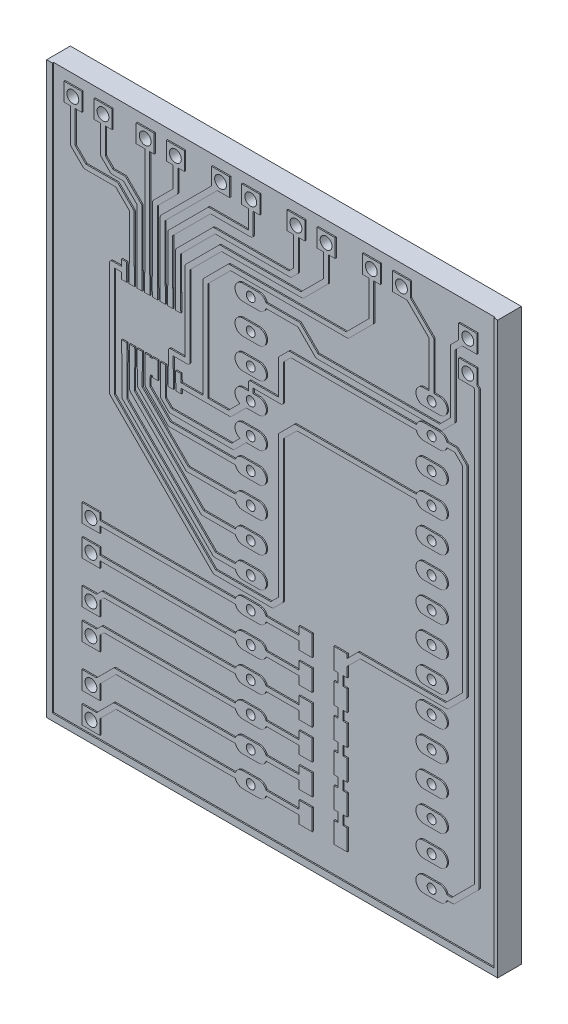
from build123d import *

# Parameters (mm, degrees)
SKETCH2_W           = 38
SKETCH2_H           = 48
BOSS_EXTRUDE1_DEPTH = 2
MODEL_W             = 37.1856
MODEL_H             = 47.8536
CUT_EXTRUDE1_DEPTH  = 0.1
MODEL_5_R           = 0.3750056
MODEL_5_R_2         = 0.499999
CUT_EXTRUDE2_DEPTH  = 62.253571324


with BuildPart() as part:
    # Sketch2 → Boss-Extrude1 (new body)
    with BuildSketch(Plane.XY):
        with Locations((19, 24)):
            Rectangle(SKETCH2_W, SKETCH2_H)
    extrude(amount=-BOSS_EXTRUDE1_DEPTH)

    # Model → Cut-Extrude1 (cut)
    with BuildSketch(Plane.XY):
        with Locations((19.090426819, 24.502154165)):
            Rectangle(MODEL_W, MODEL_H)
        with BuildLine():
            Line((2.9718, 0.9398), (2.9718, 2.4638))
            Line((2.9718, 2.4638), (4.20841808, 2.4638))
            Line((4.20841808, 2.4638), (5.622110349, 3.877492269))
            ThreePointArc((5.622110349, 3.877492269), (5.688034023, 3.921541059), (5.765796298, 3.937008938))
            Line((5.765796298, 3.937008938), (15.903743147, 3.937008938))
            ThreePointArc((15.903743147, 3.937008938), (16.144601357, 4.270046839), (16.5354, 4.397339187))
            Line((16.5354, 4.397339187), (17.8562, 4.397339187))
            ThreePointArc((17.8562, 4.397339187), (18.246998643, 4.270046839), (18.487856853, 3.937008938))
            Line((18.487856853, 3.937008938), (21.2598, 3.937008938))
            Line((21.2598, 3.937008938), (21.2598, 4.6101))
            Line((21.2598, 4.6101), (22.3774, 4.6101))
            Line((22.3774, 4.6101), (22.3774, 2.8575))
            Line((22.3774, 2.8575), (21.2598, 2.8575))
            Line((21.2598, 2.8575), (21.2598, 3.5306))
            Line((21.2598, 3.5306), (18.487859728, 3.5306))
            ThreePointArc((18.487859728, 3.5306), (18.247002437, 3.197555925), (17.8562, 3.070260813))
            Line((17.8562, 3.070260813), (16.5354, 3.070260813))
            ThreePointArc((16.5354, 3.070260813), (16.144597563, 3.197555925), (15.903740272, 3.5306))
            Line((15.903740272, 3.5306), (5.84996928, 3.5306))
            Line((5.84996928, 3.5306), (4.4958, 2.17643072))
            Line((4.4958, 2.17643072), (4.4958, 0.9398))
            Line((4.4958, 0.9398), (2.9718, 0.9398))
        make_face(mode=Mode.SUBTRACT)
        with BuildLine():
            Line((2.9718, 3.4798), (2.9718, 5.0038))
            Line((2.9718, 5.0038), (4.20841808, 5.0038))
            Line((4.20841808, 5.0038), (5.622110349, 6.417492269))
            ThreePointArc((5.622110349, 6.417492269), (5.688034023, 6.461541059), (5.765796298, 6.477008938))
            Line((5.765796298, 6.477008938), (15.903743147, 6.477008938))
            ThreePointArc((15.903743147, 6.477008938), (16.144601357, 6.810046839), (16.5354, 6.937339187))
            Line((16.5354, 6.937339187), (17.8562, 6.937339187))
            ThreePointArc((17.8562, 6.937339187), (18.246998643, 6.810046839), (18.487856853, 6.477008938))
            Line((18.487856853, 6.477008938), (21.2598, 6.477008938))
            Line((21.2598, 6.477008938), (21.2598, 7.1501))
            Line((21.2598, 7.1501), (22.3774, 7.1501))
            Line((22.3774, 7.1501), (22.3774, 5.3975))
            Line((22.3774, 5.3975), (21.2598, 5.3975))
            Line((21.2598, 5.3975), (21.2598, 6.0706))
            Line((21.2598, 6.0706), (18.487859728, 6.0706))
            ThreePointArc((18.487859728, 6.0706), (18.247002437, 5.737555925), (17.8562, 5.610260813))
            Line((17.8562, 5.610260813), (16.5354, 5.610260813))
            ThreePointArc((16.5354, 5.610260813), (16.144597563, 5.737555925), (15.903740272, 6.0706))
            Line((15.903740272, 6.0706), (5.84996928, 6.0706))
            Line((5.84996928, 6.0706), (4.4958, 4.71643072))
            Line((4.4958, 4.71643072), (4.4958, 3.4798))
            Line((4.4958, 3.4798), (2.9718, 3.4798))
        make_face(mode=Mode.SUBTRACT)
        with BuildLine():
            Line((2.9718, 7.0358), (2.9718, 8.5598))
            Line((2.9718, 8.5598), (4.20841808, 8.5598))
            Line((4.20841808, 8.5598), (4.606110349, 8.957492269))
            ThreePointArc((4.606110349, 8.957492269), (4.672034023, 9.001541059), (4.749796298, 9.017008938))
            Line((4.749796298, 9.017008938), (15.903743147, 9.017008938))
            ThreePointArc((15.903743147, 9.017008938), (16.144601357, 9.350046839), (16.5354, 9.477339187))
            Line((16.5354, 9.477339187), (17.8562, 9.477339187))
            ThreePointArc((17.8562, 9.477339187), (18.246998643, 9.350046839), (18.487856853, 9.017008938))
            Line((18.487856853, 9.017008938), (21.2598, 9.017008938))
            Line((21.2598, 9.017008938), (21.2598, 9.6901))
            Line((21.2598, 9.6901), (22.3774, 9.6901))
            Line((22.3774, 9.6901), (22.3774, 7.9375))
            Line((22.3774, 7.9375), (21.2598, 7.9375))
            Line((21.2598, 7.9375), (21.2598, 8.6106))
            Line((21.2598, 8.6106), (18.487859728, 8.6106))
            ThreePointArc((18.487859728, 8.6106), (18.247002437, 8.277555925), (17.8562, 8.150260813))
            Line((17.8562, 8.150260813), (16.5354, 8.150260813))
            ThreePointArc((16.5354, 8.150260813), (16.144597563, 8.277555925), (15.903740272, 8.6106))
            Line((15.903740272, 8.6106), (4.83396928, 8.6106))
            Line((4.83396928, 8.6106), (4.4958, 8.27243072))
            Line((4.4958, 8.27243072), (4.4958, 7.0358))
            Line((4.4958, 7.0358), (2.9718, 7.0358))
        make_face(mode=Mode.SUBTRACT)
        with BuildLine():
            Line((2.9718, 9.5758), (2.9718, 11.0998))
            Line((2.9718, 11.0998), (4.20841808, 11.0998))
            Line((4.20841808, 11.0998), (4.606110349, 11.497492269))
            ThreePointArc((4.606110349, 11.497492269), (4.672034023, 11.541541059), (4.749796298, 11.557008938))
            Line((4.749796298, 11.557008938), (15.903743147, 11.557008938))
            ThreePointArc((15.903743147, 11.557008938), (16.144601357, 11.890046839), (16.5354, 12.017339187))
            Line((16.5354, 12.017339187), (17.8562, 12.017339187))
            ThreePointArc((17.8562, 12.017339187), (18.246998643, 11.890046839), (18.487856853, 11.557008938))
            Line((18.487856853, 11.557008938), (19.989796298, 11.557008938))
            Line((19.989796298, 11.557008938), (21.2598, 11.557008938))
            Line((21.2598, 11.557008938), (21.2598, 12.2301))
            Line((21.2598, 12.2301), (22.3774, 12.2301))
            Line((22.3774, 12.2301), (22.3774, 10.4775))
            Line((22.3774, 10.4775), (21.2598, 10.4775))
            Line((21.2598, 10.4775), (21.2598, 11.150608938))
            Line((21.2598, 11.150608938), (19.989796298, 11.150608938))
            Line((19.989796298, 11.150608938), (18.487862604, 11.150608938))
            ThreePointArc((18.487862604, 11.150608938), (18.247006231, 10.81755869), (17.8562, 10.690260813))
            Line((17.8562, 10.690260813), (16.5354, 10.690260813))
            ThreePointArc((16.5354, 10.690260813), (16.144593769, 10.81755869), (15.903737396, 11.150608938))
            Line((15.903737396, 11.150608938), (4.833978218, 11.150608938))
            Line((4.833978218, 11.150608938), (4.4958, 10.81243072))
            Line((4.4958, 10.81243072), (4.4958, 9.5758))
            Line((4.4958, 9.5758), (2.9718, 9.5758))
        make_face(mode=Mode.SUBTRACT)
        with BuildLine():
            Line((2.9718, 13.1318), (2.9718, 14.6558))
            Line((2.9718, 14.6558), (4.4958, 14.6558))
            Line((4.4958, 14.6558), (4.4958, 14.097))
            Line((4.4958, 14.097), (7.2898, 14.097))
            Line((7.2898, 14.097), (15.903740272, 14.097))
            ThreePointArc((15.903740272, 14.097), (16.144597563, 14.430044075), (16.5354, 14.557339187))
            Line((16.5354, 14.557339187), (17.8562, 14.557339187))
            ThreePointArc((17.8562, 14.557339187), (18.247002437, 14.430044075), (18.487859728, 14.097))
            Line((18.487859728, 14.097), (21.2598, 14.097))
            Line((21.2598, 14.097), (21.2598, 14.7701))
            Line((21.2598, 14.7701), (22.3774, 14.7701))
            Line((22.3774, 14.7701), (22.3774, 13.0175))
            Line((22.3774, 13.0175), (21.2598, 13.0175))
            Line((21.2598, 13.0175), (21.2598, 13.6906))
            Line((21.2598, 13.6906), (18.487859728, 13.6906))
            ThreePointArc((18.487859728, 13.6906), (18.247002437, 13.357555925), (17.8562, 13.230260813))
            Line((17.8562, 13.230260813), (16.5354, 13.230260813))
            ThreePointArc((16.5354, 13.230260813), (16.144597563, 13.357555925), (15.903740272, 13.6906))
            Line((15.903740272, 13.6906), (7.2898, 13.6906))
            Line((7.2898, 13.6906), (4.4958, 13.6906))
            Line((4.4958, 13.6906), (4.4958, 13.1318))
            Line((4.4958, 13.1318), (2.9718, 13.1318))
        make_face(mode=Mode.SUBTRACT)
        with BuildLine():
            Line((2.9718, 15.6718), (2.9718, 17.1958))
            Line((2.9718, 17.1958), (4.4958, 17.1958))
            Line((4.4958, 17.1958), (4.4958, 16.637))
            Line((4.4958, 16.637), (7.2898, 16.637))
            Line((7.2898, 16.637), (15.903740272, 16.637))
            ThreePointArc((15.903740272, 16.637), (16.144597563, 16.970044075), (16.5354, 17.097339187))
            Line((16.5354, 17.097339187), (17.8562, 17.097339187))
            ThreePointArc((17.8562, 17.097339187), (18.247002437, 16.970044075), (18.487859728, 16.637))
            Line((18.487859728, 16.637), (21.2598, 16.637))
            Line((21.2598, 16.637), (21.2598, 17.3101))
            Line((21.2598, 17.3101), (22.3774, 17.3101))
            Line((22.3774, 17.3101), (22.3774, 15.5575))
            Line((22.3774, 15.5575), (21.2598, 15.5575))
            Line((21.2598, 15.5575), (21.2598, 16.2306))
            Line((21.2598, 16.2306), (18.487859728, 16.2306))
            ThreePointArc((18.487859728, 16.2306), (18.247002437, 15.897555925), (17.8562, 15.770260813))
            Line((17.8562, 15.770260813), (16.5354, 15.770260813))
            ThreePointArc((16.5354, 15.770260813), (16.144597563, 15.897555925), (15.903740272, 16.2306))
            Line((15.903740272, 16.2306), (7.2898, 16.2306))
            Line((7.2898, 16.2306), (4.4958, 16.2306))
            Line((4.4958, 16.2306), (4.4958, 15.6718))
            Line((4.4958, 15.6718), (2.9718, 15.6718))
        make_face(mode=Mode.SUBTRACT)
        with BuildLine():
            ThreePointArc((31.7754, 5.610260813), (31.111860813, 6.2738), (31.7754, 6.937339187))
            Line((31.7754, 6.937339187), (33.0962, 6.937339187))
            ThreePointArc((33.0962, 6.937339187), (33.759739187, 6.2738), (33.0962, 5.610260813))
            Line((33.0962, 5.610260813), (31.7754, 5.610260813))
        make_face(mode=Mode.SUBTRACT)
        with BuildLine():
            ThreePointArc((31.7754, 8.150260813), (31.111860813, 8.8138), (31.7754, 9.477339187))
            Line((31.7754, 9.477339187), (33.0962, 9.477339187))
            ThreePointArc((33.0962, 9.477339187), (33.759739187, 8.8138), (33.0962, 8.150260813))
            Line((33.0962, 8.150260813), (31.7754, 8.150260813))
        make_face(mode=Mode.SUBTRACT)
        with BuildLine():
            ThreePointArc((31.7754, 10.690260813), (31.111860813, 11.3538), (31.7754, 12.017339187))
            Line((31.7754, 12.017339187), (33.0962, 12.017339187))
            ThreePointArc((33.0962, 12.017339187), (33.759739187, 11.3538), (33.0962, 10.690260813))
            Line((33.0962, 10.690260813), (31.7754, 10.690260813))
        make_face(mode=Mode.SUBTRACT)
        with BuildLine():
            ThreePointArc((31.7754, 13.230260813), (31.111860813, 13.8938), (31.7754, 14.557339187))
            Line((31.7754, 14.557339187), (33.0962, 14.557339187))
            ThreePointArc((33.0962, 14.557339187), (33.759739187, 13.8938), (33.0962, 13.230260813))
            Line((33.0962, 13.230260813), (31.7754, 13.230260813))
        make_face(mode=Mode.SUBTRACT)
        with BuildLine():
            ThreePointArc((31.7754, 15.770260813), (31.111860813, 16.4338), (31.7754, 17.097339187))
            Line((31.7754, 17.097339187), (33.0962, 17.097339187))
            ThreePointArc((33.0962, 17.097339187), (33.759739187, 16.4338), (33.0962, 15.770260813))
            Line((33.0962, 15.770260813), (31.7754, 15.770260813))
        make_face(mode=Mode.SUBTRACT)
        with BuildLine():
            ThreePointArc((31.7754, 18.310260813), (31.111860813, 18.9738), (31.7754, 19.637339187))
            Line((31.7754, 19.637339187), (33.0962, 19.637339187))
            ThreePointArc((33.0962, 19.637339187), (33.759739187, 18.9738), (33.0962, 18.310260813))
            Line((33.0962, 18.310260813), (31.7754, 18.310260813))
        make_face(mode=Mode.SUBTRACT)
        with BuildLine():
            ThreePointArc((31.7754, 20.850260813), (31.111860813, 21.5138), (31.7754, 22.177339187))
            Line((31.7754, 22.177339187), (33.0962, 22.177339187))
            ThreePointArc((33.0962, 22.177339187), (33.759739187, 21.5138), (33.0962, 20.850260813))
            Line((33.0962, 20.850260813), (31.7754, 20.850260813))
        make_face(mode=Mode.SUBTRACT)
        with BuildLine():
            ThreePointArc((31.7754, 23.390260813), (31.111860813, 24.0538), (31.7754, 24.717339187))
            Line((31.7754, 24.717339187), (33.0962, 24.717339187))
            ThreePointArc((33.0962, 24.717339187), (33.759739187, 24.0538), (33.0962, 23.390260813))
            Line((33.0962, 23.390260813), (31.7754, 23.390260813))
        make_face(mode=Mode.SUBTRACT)
        with BuildLine():
            Line((34.7218, 42.0878), (34.7218, 43.6118))
            Line((34.7218, 43.6118), (36.2458, 43.6118))
            Line((36.2458, 43.6118), (36.2458, 42.375179302))
            Line((36.2458, 42.375179302), (36.389489651, 42.231489651))
            ThreePointArc((36.389489651, 42.231489651), (36.433538289, 42.165565717), (36.449006105, 42.087803295))
            Line((36.449006105, 42.087803295), (36.449006105, 5.765803295))
            ThreePointArc((36.449006105, 5.765803295), (36.433538625, 5.688038079), (36.389488542, 5.622111893))
            Line((36.389488542, 5.622111893), (34.357488542, 3.590111893))
            ThreePointArc((34.357488542, 3.590111893), (34.291565097, 3.546063147), (34.213803039, 3.530595281))
            Line((34.213803039, 3.530595281), (33.72785821, 3.530595281))
            ThreePointArc((33.72785821, 3.530595281), (33.487000434, 3.197554466), (33.0962, 3.070260813))
            Line((33.0962, 3.070260813), (31.7754, 3.070260813))
            ThreePointArc((31.7754, 3.070260813), (31.111860813, 3.7338), (31.7754, 4.397339187))
            Line((31.7754, 4.397339187), (33.0962, 4.397339187))
            ThreePointArc((33.0962, 4.397339187), (33.48700444, 4.270042615), (33.727861246, 3.936995281))
            Line((33.727861246, 3.936995281), (34.129623383, 3.936995281))
            Line((34.129623383, 3.936995281), (36.042597382, 5.84996928))
            Line((36.042597382, 5.84996928), (36.042597382, 42.00363072))
            Line((36.042597382, 42.00363072), (35.958428102, 42.0878))
            Line((35.958428102, 42.0878), (34.7218, 42.0878))
        make_face(mode=Mode.SUBTRACT)
        with BuildLine():
            Line((6.775357283, 30.732589913), (6.783080348, 29.257606732))
            Line((6.783080348, 29.257606732), (6.757416, 29.257472353))
            Line((6.757416, 29.257472353), (6.757416, 26.65155328))
            Line((6.757416, 26.65155328), (14.231966662, 19.177002618))
            Line((14.231966662, 19.177002618), (15.903741114, 19.177002618))
            ThreePointArc((15.903741114, 19.177002618), (16.144598674, 19.510044884), (16.5354, 19.637339187))
            Line((16.5354, 19.637339187), (17.8562, 19.637339187))
            ThreePointArc((17.8562, 19.637339187), (18.519739187, 18.9738), (17.8562, 18.310260813))
            Line((17.8562, 18.310260813), (16.5354, 18.310260813))
            ThreePointArc((16.5354, 18.310260813), (16.14459677, 18.437556503), (15.903739671, 18.770601867))
            Line((15.903739671, 18.770601867), (14.147797071, 18.770601867))
            ThreePointArc((14.147797071, 18.770601867), (14.070038467, 18.78606862), (14.004117323, 18.830114322))
            Line((14.004117323, 18.830114322), (6.410533323, 26.423698322))
            ThreePointArc((6.410533323, 26.423698322), (6.366484062, 26.489621725), (6.351016, 26.567384))
            Line((6.351016, 26.567384), (6.351016, 29.255344428))
            Line((6.351016, 29.255344428), (6.333074717, 29.255250487))
            Line((6.333074717, 29.255250487), (6.325351652, 30.730233668))
            Line((6.325351652, 30.730233668), (6.775357283, 30.732589913))
        make_face(mode=Mode.SUBTRACT)
        with BuildLine():
            Line((7.425343283, 30.735993513), (7.433066348, 29.261010332))
            Line((7.433066348, 29.261010332), (7.407402, 29.260875953))
            Line((7.407402, 29.260875953), (7.407402, 27.52556728))
            Line((7.407402, 27.52556728), (13.215966662, 21.717002618))
            Line((13.215966662, 21.717002618), (15.903741114, 21.717002618))
            ThreePointArc((15.903741114, 21.717002618), (16.144598674, 22.050044884), (16.5354, 22.177339187))
            Line((16.5354, 22.177339187), (17.8562, 22.177339187))
            ThreePointArc((17.8562, 22.177339187), (18.519739187, 21.5138), (17.8562, 20.850260813))
            Line((17.8562, 20.850260813), (16.5354, 20.850260813))
            ThreePointArc((16.5354, 20.850260813), (16.14459677, 20.977556503), (15.903739671, 21.310601867))
            Line((15.903739671, 21.310601867), (13.131797071, 21.310601867))
            ThreePointArc((13.131797071, 21.310601867), (13.054038467, 21.32606862), (12.988117323, 21.370114322))
            Line((12.988117323, 21.370114322), (7.060519323, 27.297712322))
            ThreePointArc((7.060519323, 27.297712322), (7.016470062, 27.363635725), (7.001002, 27.441398))
            Line((7.001002, 27.441398), (7.001002, 29.258748028))
            Line((7.001002, 29.258748028), (6.983060717, 29.258654087))
            Line((6.983060717, 29.258654087), (6.975337652, 30.733637268))
            Line((6.975337652, 30.733637268), (7.425343283, 30.735993513))
        make_face(mode=Mode.SUBTRACT)
        with BuildLine():
            Line((8.075329284, 30.739397113), (8.083052348, 29.264413932))
            Line((8.083052348, 29.264413932), (8.057388, 29.264279553))
            Line((8.057388, 29.264279553), (8.057388, 28.14558128))
            Line((8.057388, 28.14558128), (11.945966662, 24.257002618))
            Line((11.945966662, 24.257002618), (15.903741114, 24.257002618))
            ThreePointArc((15.903741114, 24.257002618), (16.144598674, 24.590044884), (16.5354, 24.717339187))
            Line((16.5354, 24.717339187), (17.8562, 24.717339187))
            ThreePointArc((17.8562, 24.717339187), (18.519739187, 24.0538), (17.8562, 23.390260813))
            Line((17.8562, 23.390260813), (16.5354, 23.390260813))
            ThreePointArc((16.5354, 23.390260813), (16.14459677, 23.517556503), (15.903739671, 23.850601867))
            Line((15.903739671, 23.850601867), (11.861797071, 23.850601867))
            ThreePointArc((11.861797071, 23.850601867), (11.784038467, 23.86606862), (11.718117323, 23.910114322))
            Line((11.718117323, 23.910114322), (7.710505323, 27.917726322))
            ThreePointArc((7.710505323, 27.917726322), (7.666456062, 27.983649725), (7.650988, 28.061412))
            Line((7.650988, 28.061412), (7.650988, 29.262151628))
            Line((7.650988, 29.262151628), (7.633046717, 29.262057687))
            Line((7.633046717, 29.262057687), (7.625323652, 30.737040868))
            Line((7.625323652, 30.737040868), (8.075329284, 30.739397113))
        make_face(mode=Mode.SUBTRACT)
        with BuildLine():
            Line((8.732378933, 29.398606427), (8.733063748, 29.267817532))
            Line((8.733063748, 29.267817532), (8.7073994, 29.0068))
            Line((8.7073994, 29.0068), (8.7073994, 28.511545305))
            Line((8.7073994, 28.511545305), (10.421968456, 26.797))
            Line((10.421968456, 26.797), (15.903740272, 26.797))
            ThreePointArc((15.903740272, 26.797), (16.144597563, 27.130044075), (16.5354, 27.257339187))
            Line((16.5354, 27.257339187), (17.8562, 27.257339187))
            ThreePointArc((17.8562, 27.257339187), (18.519739187, 26.5938), (17.8562, 25.930260813))
            Line((17.8562, 25.930260813), (16.5354, 25.930260813))
            ThreePointArc((16.5354, 25.930260813), (16.144600555, 26.057553745), (15.903742539, 26.390592951))
            Line((15.903742539, 26.390592951), (10.33779708, 26.390592951))
            ThreePointArc((10.33779708, 26.390592951), (10.260033942, 26.406061278), (10.194109944, 26.450111266))
            Line((10.194109944, 26.450111266), (8.360509344, 28.283737266))
            ThreePointArc((8.360509344, 28.283737266), (8.316467091, 28.349650685), (8.3009994, 28.4274006))
            Line((8.3009994, 28.4274006), (8.3009994, 29.0068))
            Line((8.3009994, 29.0068), (8.283058117, 29.265461287))
            Line((8.283058117, 29.265461287), (8.275335052, 30.740444468))
            Line((8.275335052, 30.740444468), (8.725340683, 30.742800713))
            Line((8.725340683, 30.742800713), (8.725815464, 30.652125142))
            Line((8.725815464, 30.652125142), (8.925801317, 30.652125142))
            Line((8.925801317, 30.652125142), (8.925321052, 30.743848068))
            Line((8.925321052, 30.743848068), (9.375326683, 30.746204313))
            Line((9.375326683, 30.746204313), (9.383049748, 29.271221132))
            Line((9.383049748, 29.271221132), (8.933044117, 29.268864887))
            Line((8.933044117, 29.268864887), (8.932364785, 29.398606427))
            Line((8.932364785, 29.398606427), (8.732378933, 29.398606427))
        make_face(mode=Mode.SUBTRACT)
        with BuildLine():
            Line((10.025312683, 30.749607913), (10.033035748, 29.274624732))
            Line((10.033035748, 29.274624732), (10.0073714, 29.274490353))
            Line((10.0073714, 29.274490353), (10.0073714, 28.31710748))
            Line((10.0073714, 28.31710748), (10.511476262, 27.813002618))
            Line((10.511476262, 27.813002618), (15.587618935, 27.813002618))
            Line((15.587618935, 27.813002618), (16.291377285, 28.516760968))
            ThreePointArc((16.291377285, 28.516760968), (15.88358951, 29.258006833), (16.5354, 29.797339187))
            Line((16.5354, 29.797339187), (17.8562, 29.797339187))
            ThreePointArc((17.8562, 29.797339187), (18.519739187, 29.1338), (17.8562, 28.470260813))
            Line((17.8562, 28.470260813), (16.819628331, 28.470260813))
            Line((16.819628331, 28.470260813), (15.815484348, 27.466116831))
            ThreePointArc((15.815484348, 27.466116831), (15.749561368, 27.422068209), (15.671799893, 27.406599741))
            Line((15.671799893, 27.406599741), (10.427309493, 27.406599741))
            ThreePointArc((10.427309493, 27.406599741), (10.349549203, 27.422067124), (10.283626923, 27.466114322))
            Line((10.283626923, 27.466114322), (9.660488723, 28.089252522))
            ThreePointArc((9.660488723, 28.089252522), (9.616439462, 28.155175925), (9.6009714, 28.2329382))
            Line((9.6009714, 28.2329382), (9.6009714, 29.272362428))
            Line((9.6009714, 29.272362428), (9.583030117, 29.272268487))
            Line((9.583030117, 29.272268487), (9.575307052, 30.747251668))
            Line((9.575307052, 30.747251668), (10.025312683, 30.749607913))
        make_face(mode=Mode.SUBTRACT)
        with BuildLine():
            ThreePointArc((16.5354, 33.550260813), (15.871860813, 34.2138), (16.5354, 34.877339187))
            Line((16.5354, 34.877339187), (17.8562, 34.877339187))
            ThreePointArc((17.8562, 34.877339187), (18.519739187, 34.2138), (17.8562, 33.550260813))
            Line((17.8562, 33.550260813), (16.5354, 33.550260813))
        make_face(mode=Mode.SUBTRACT)
        with BuildLine():
            Line((2.9718, 45.6438), (2.413, 45.6438))
            Line((2.413, 45.6438), (2.413, 42.93396928))
            Line((2.413, 42.93396928), (3.309966662, 42.037002618))
            Line((3.309966662, 42.037002618), (5.903439982, 42.037002618))
            ThreePointArc((5.903439982, 42.037002618), (5.981204466, 42.021536399), (6.047130265, 41.977487473))
            Line((6.047130265, 41.977487473), (7.317130265, 40.707487473))
            ThreePointArc((7.317130265, 40.707487473), (7.361175373, 40.641563614), (7.376639982, 40.563802618))
            Line((7.376639982, 40.563802618), (7.376639982, 36.611833958))
            Line((7.376639982, 36.611833958), (7.394583883, 36.611927913))
            Line((7.394583883, 36.611927913), (7.402306948, 35.136944732))
            Line((7.402306948, 35.136944732), (6.952301317, 35.134588487))
            Line((6.952301317, 35.134588487), (6.944578252, 36.609571668))
            Line((6.944578252, 36.609571668), (6.970239982, 36.609706033))
            Line((6.970239982, 36.609706033), (6.970239982, 40.479636498))
            Line((6.970239982, 40.479636498), (5.819277246, 41.630599233))
            Line((5.819277246, 41.630599233), (3.225803927, 41.630599233))
            ThreePointArc((3.225803927, 41.630599233), (3.148041452, 41.646066186), (3.082117323, 41.690114322))
            Line((3.082117323, 41.690114322), (2.066117323, 42.706114322))
            ThreePointArc((2.066117323, 42.706114322), (2.022068062, 42.772037725), (2.0066, 42.8498))
            Line((2.0066, 42.8498), (2.0066, 45.6438))
            Line((2.0066, 45.6438), (1.4478, 45.6438))
            Line((1.4478, 45.6438), (1.4478, 47.1678))
            Line((1.4478, 47.1678), (2.9718, 47.1678))
            Line((2.9718, 47.1678), (2.9718, 45.6438))
        make_face(mode=Mode.SUBTRACT)
        with BuildLine():
            Line((8.044569883, 36.615331513), (8.052292948, 35.140348332))
            Line((8.052292948, 35.140348332), (7.602287317, 35.137992087))
            Line((7.602287317, 35.137992087), (7.594564252, 36.612975268))
            Line((7.594564252, 36.612975268), (7.6202286, 36.613109647))
            Line((7.6202286, 36.613109647), (7.6202286, 41.241635979))
            Line((7.6202286, 41.241635979), (6.469263478, 42.392601101))
            Line((6.469263478, 42.392601101), (5.511804158, 42.392601101))
            ThreePointArc((5.511804158, 42.392601101), (5.434041735, 42.408067051), (5.368117323, 42.452114322))
            Line((5.368117323, 42.452114322), (4.606117323, 43.214114322))
            ThreePointArc((4.606117323, 43.214114322), (4.562068062, 43.280037725), (4.5466, 43.3578))
            Line((4.5466, 43.3578), (4.5466, 45.6438))
            Line((4.5466, 45.6438), (3.9878, 45.6438))
            Line((3.9878, 45.6438), (3.9878, 47.1678))
            Line((3.9878, 47.1678), (5.5118, 47.1678))
            Line((5.5118, 47.1678), (5.5118, 45.6438))
            Line((5.5118, 45.6438), (4.953, 45.6438))
            Line((4.953, 45.6438), (4.953, 43.44196928))
            Line((4.953, 43.44196928), (5.595966662, 42.799002618))
            Line((5.595966662, 42.799002618), (6.553425982, 42.799002618))
            ThreePointArc((6.553425982, 42.799002618), (6.631190483, 42.783536349), (6.697116129, 42.739487146))
            Line((6.697116129, 42.739487146), (7.967116129, 41.469487146))
            ThreePointArc((7.967116129, 41.469487146), (8.011163226, 41.403562575), (8.0266286, 41.3258))
            Line((8.0266286, 41.3258), (8.0266286, 36.615237572))
            Line((8.0266286, 36.615237572), (8.044569883, 36.615331513))
        make_face(mode=Mode.SUBTRACT)
        Polygon((8.694555883, 36.618735113), (8.702278948, 35.143751932), (8.252273317, 35.141395687), (8.244550252, 36.616378868), (8.2702146, 36.616513247), (8.2702146, 45.6438), (7.5438, 45.6438), (7.5438, 47.1678), (9.0678, 47.1678), (9.0678, 45.6438), (8.6766146, 45.6438), (8.6766146, 36.618641172), align=None, mode=Mode.SUBTRACT)
        with BuildLine():
            Line((9.344541883, 36.622138713), (9.352264948, 35.147155532))
            Line((9.352264948, 35.147155532), (8.902259317, 35.144799287))
            Line((8.902259317, 35.144799287), (8.894536252, 36.619782468))
            Line((8.894536252, 36.619782468), (8.9202006, 36.619916847))
            Line((8.9202006, 36.619916847), (8.9202006, 42.0878))
            ThreePointArc((8.9202006, 42.0878), (8.935668138, 42.165562416), (8.979717269, 42.231485949))
            Line((8.979717269, 42.231485949), (10.6426, 43.89436868))
            Line((10.6426, 43.89436868), (10.6426, 45.6438))
            Line((10.6426, 45.6438), (10.0838, 45.6438))
            Line((10.0838, 45.6438), (10.0838, 47.1678))
            Line((10.0838, 47.1678), (11.6078, 47.1678))
            Line((11.6078, 47.1678), (11.6078, 45.6438))
            Line((11.6078, 45.6438), (11.049, 45.6438))
            Line((11.049, 45.6438), (11.049, 43.8101994))
            ThreePointArc((11.049, 43.8101994), (11.033532462, 43.732436984), (10.989483331, 43.666513451))
            Line((10.989483331, 43.666513451), (9.3266006, 42.00363072))
            Line((9.3266006, 42.00363072), (9.3266006, 36.622044772))
            Line((9.3266006, 36.622044772), (9.344541883, 36.622138713))
        make_face(mode=Mode.SUBTRACT)
        with BuildLine():
            Line((9.994553283, 36.625542313), (10.002276348, 35.150559132))
            Line((10.002276348, 35.150559132), (9.552270717, 35.148202887))
            Line((9.552270717, 35.148202887), (9.544547652, 36.623186068))
            Line((9.544547652, 36.623186068), (9.570212, 36.623320447))
            Line((9.570212, 36.623320447), (9.570212, 41.3258))
            ThreePointArc((9.570212, 41.3258), (9.585680246, 41.403562275), (9.629729978, 41.469485407))
            Line((9.629729978, 41.469485407), (13.893801309, 45.733556738))
            Line((13.893801309, 45.733556738), (13.893801309, 47.167799458))
            Line((13.893801309, 47.167799458), (15.4178, 47.167799458))
            Line((15.4178, 47.167799458), (15.4178, 45.6438))
            Line((15.4178, 45.6438), (14.37878128, 45.6438))
            Line((14.37878128, 45.6438), (9.976612, 41.24163072))
            Line((9.976612, 41.24163072), (9.976612, 36.625448372))
            Line((9.976612, 36.625448372), (9.994553283, 36.625542313))
        make_face(mode=Mode.SUBTRACT)
        with BuildLine():
            Line((10.644539283, 36.628945913), (10.652262348, 35.153962732))
            Line((10.652262348, 35.153962732), (10.202256717, 35.151606487))
            Line((10.202256717, 35.151606487), (10.194533652, 36.626589668))
            Line((10.194533652, 36.626589668), (10.220198, 36.626724047))
            Line((10.220198, 36.626724047), (10.220198, 40.5638))
            ThreePointArc((10.220198, 40.5638), (10.235666062, 40.641562275), (10.279715323, 40.707485678))
            Line((10.279715323, 40.707485678), (13.581715323, 44.009485678))
            ThreePointArc((13.581715323, 44.009485678), (13.647638101, 44.053532164), (13.725398615, 44.068998516))
            Line((13.725398615, 44.068998516), (16.992600615, 44.068998516))
            Line((16.992600615, 44.068998516), (16.992600615, 45.643798516))
            Line((16.992600615, 45.643798516), (16.433800615, 45.643798516))
            Line((16.433800615, 45.643798516), (16.433800615, 47.167798516))
            Line((16.433800615, 47.167798516), (17.957800615, 47.167798516))
            Line((17.957800615, 47.167798516), (17.957800615, 45.643798516))
            Line((17.957800615, 45.643798516), (17.399001182, 45.643798516))
            Line((17.399001182, 45.643798516), (17.399001182, 43.865797949))
            ThreePointArc((17.399001182, 43.865797949), (17.339483971, 43.722112307), (17.195797382, 43.662597382))
            Line((17.195797382, 43.662597382), (13.809564662, 43.662597382))
            Line((13.809564662, 43.662597382), (10.626598, 40.47963072))
            Line((10.626598, 40.47963072), (10.626598, 36.628851972))
            Line((10.626598, 36.628851972), (10.644539283, 36.628945913))
        make_face(mode=Mode.SUBTRACT)
        with BuildLine():
            ThreePointArc((16.5354, 36.090260813), (15.871860813, 36.7538), (16.5354, 37.417339187))
            Line((16.5354, 37.417339187), (17.8562, 37.417339187))
            ThreePointArc((17.8562, 37.417339187), (18.519739187, 36.7538), (17.8562, 36.090260813))
            Line((17.8562, 36.090260813), (16.5354, 36.090260813))
        make_face(mode=Mode.SUBTRACT)
        with BuildLine():
            Line((10.675298683, 30.753011513), (10.683021748, 29.278028332))
            Line((10.683021748, 29.278028332), (10.233016117, 29.275672087))
            Line((10.233016117, 29.275672087), (10.225293052, 30.750655268))
            Line((10.225293052, 30.750655268), (10.2509574, 30.750789647))
            Line((10.2509574, 30.750789647), (10.2509574, 31.9278))
            ThreePointArc((10.2509574, 31.9278), (10.310473302, 32.071483943), (10.454157336, 32.130999625))
            Line((10.454157336, 32.130999625), (11.658600311, 32.130999625))
            Line((11.658600311, 32.130999625), (11.658600311, 38.78579925))
            ThreePointArc((11.658600311, 38.78579925), (11.674068713, 38.863561384), (11.718117634, 38.929484928))
            Line((11.718117634, 38.929484928), (14.512117634, 41.723484928))
            ThreePointArc((14.512117634, 41.723484928), (14.578039826, 41.767532199), (14.6558, 41.783))
            Line((14.6558, 41.783), (21.42963072, 41.783))
            Line((21.42963072, 41.783), (23.342597382, 43.695966662))
            Line((23.342597382, 43.695966662), (23.342597382, 45.6438))
            Line((23.342597382, 45.6438), (22.7838, 45.6438))
            Line((22.7838, 45.6438), (22.7838, 47.1678))
            Line((22.7838, 47.1678), (24.3078, 47.1678))
            Line((24.3078, 47.1678), (24.3078, 45.6438))
            Line((24.3078, 45.6438), (23.748997382, 45.6438))
            Line((23.748997382, 45.6438), (23.748997382, 43.611797382))
            ThreePointArc((23.748997382, 43.611797382), (23.733530182, 43.534037318), (23.689483252, 43.468115168))
            Line((23.689483252, 43.468115168), (21.657483252, 41.436115168))
            ThreePointArc((21.657483252, 41.436115168), (21.591559979, 41.392065777), (21.513797845, 41.376597191))
            Line((21.513797845, 41.376597191), (14.739967125, 41.376597191))
            Line((14.739967125, 41.376597191), (12.065000463, 38.701630528))
            Line((12.065000463, 38.701630528), (12.065000463, 31.927799808))
            ThreePointArc((12.065000463, 31.927799808), (12.005484736, 31.784115451), (11.861800451, 31.724599549))
            Line((11.861800451, 31.724599549), (10.6573574, 31.724599549))
            Line((10.6573574, 31.724599549), (10.6573574, 30.752917572))
            Line((10.6573574, 30.752917572), (10.675298683, 30.753011513))
        make_face(mode=Mode.SUBTRACT)
        with BuildLine():
            Line((11.294525283, 36.632349513), (11.302248348, 35.157366332))
            Line((11.302248348, 35.157366332), (10.852242717, 35.155010087))
            Line((10.852242717, 35.155010087), (10.844519652, 36.629993268))
            Line((10.844519652, 36.629993268), (10.870184, 36.630127647))
            Line((10.870184, 36.630127647), (10.870184, 39.5478))
            ThreePointArc((10.870184, 39.5478), (10.885651723, 39.62556117), (10.929700054, 39.69148381))
            Line((10.929700054, 39.69148381), (13.977700054, 42.73948381))
            ThreePointArc((13.977700054, 42.73948381), (14.043622829, 42.78353203), (14.121384, 42.799))
            Line((14.121384, 42.799), (20.41363072, 42.799))
            Line((20.41363072, 42.799), (20.802597382, 43.187966662))
            Line((20.802597382, 43.187966662), (20.802597382, 45.6438))
            Line((20.802597382, 45.6438), (20.2438, 45.6438))
            Line((20.2438, 45.6438), (20.2438, 47.1678))
            Line((20.2438, 47.1678), (21.7678, 47.1678))
            Line((21.7678, 47.1678), (21.7678, 45.6438))
            Line((21.7678, 45.6438), (21.208997382, 45.6438))
            Line((21.208997382, 45.6438), (21.208997382, 43.103797382))
            ThreePointArc((21.208997382, 43.103797382), (21.193531695, 43.026037682), (21.149486603, 42.960115089))
            Line((21.149486603, 42.960115089), (20.641486603, 42.452115089))
            ThreePointArc((20.641486603, 42.452115089), (20.575561567, 42.408065043), (20.497797382, 42.392597382))
            Line((20.497797382, 42.392597382), (14.205550662, 42.392597382))
            Line((14.205550662, 42.392597382), (11.276584, 39.46363072))
            Line((11.276584, 39.46363072), (11.276584, 36.632255572))
            Line((11.276584, 36.632255572), (11.294525283, 36.632349513))
        make_face(mode=Mode.SUBTRACT)
        with BuildLine():
            Line((6.744597883, 36.608524313), (6.752320948, 35.133541132))
            Line((6.752320948, 35.133541132), (6.302315317, 35.131184887))
            Line((6.302315317, 35.131184887), (6.299511578, 35.6666546))
            Line((6.299511578, 35.6666546), (5.715, 35.6666546))
            Line((5.715, 35.6666546), (5.715, 26.42396928))
            Line((5.715, 26.42396928), (14.231966662, 17.907002618))
            Line((14.231966662, 17.907002618), (18.889628102, 17.907002618))
            Line((18.889628102, 17.907002618), (19.532594764, 18.54996928))
            Line((19.532594764, 18.54996928), (19.532594764, 30.4038))
            ThreePointArc((19.532594764, 30.4038), (19.548060993, 30.481563693), (19.592109197, 30.547489044))
            Line((19.592109197, 30.547489044), (20.862109197, 31.817489044))
            ThreePointArc((20.862109197, 31.817489044), (20.928032427, 31.861538604), (21.005794702, 31.877006784))
            Line((21.005794702, 31.877006784), (31.143742454, 31.877006784))
            ThreePointArc((31.143742454, 31.877006784), (31.384600442, 32.210046173), (31.7754, 32.337339187))
            Line((31.7754, 32.337339187), (33.0962, 32.337339187))
            ThreePointArc((33.0962, 32.337339187), (33.759739187, 31.6738), (33.0962, 31.010260813))
            Line((33.0962, 31.010260813), (31.7754, 31.010260813))
            ThreePointArc((31.7754, 31.010260813), (31.384594683, 31.137558024), (31.143738089, 31.470606784))
            Line((31.143738089, 31.470606784), (21.089972038, 31.470606784))
            Line((21.089972038, 31.470606784), (19.939001439, 30.319636184))
            Line((19.939001439, 30.319636184), (19.939001439, 18.465805464))
            ThreePointArc((19.939001439, 18.465805464), (19.92353322, 18.38804333), (19.87948477, 18.322119515))
            Line((19.87948477, 18.322119515), (19.11748477, 17.560119515))
            ThreePointArc((19.11748477, 17.560119515), (19.051562076, 17.516070349), (18.973800615, 17.500601484))
            Line((18.973800615, 17.500601484), (14.147800615, 17.500601484))
            ThreePointArc((14.147800615, 17.500601484), (14.070040101, 17.516067836), (14.004117323, 17.560114322))
            Line((14.004117323, 17.560114322), (5.368117323, 26.196114322))
            ThreePointArc((5.368117323, 26.196114322), (5.324068062, 26.262037725), (5.3086, 26.3398))
            Line((5.3086, 26.3398), (5.3086, 35.8698546))
            ThreePointArc((5.3086, 35.8698546), (5.368115902, 36.013538698), (5.5118, 36.0730546))
            Line((5.5118, 36.0730546), (6.297383653, 36.0730546))
            Line((6.297383653, 36.0730546), (6.294592252, 36.606168068))
            Line((6.294592252, 36.606168068), (6.744597883, 36.608524313))
        make_face(mode=Mode.SUBTRACT)
        with BuildLine():
            Line((11.330854857, 29.6926), (11.333007748, 29.281431932))
            Line((11.333007748, 29.281431932), (10.883002117, 29.279075687))
            Line((10.883002117, 29.279075687), (10.875279052, 30.754058868))
            Line((10.875279052, 30.754058868), (11.325284683, 30.756415113))
            Line((11.325284683, 30.756415113), (11.328726932, 30.099))
            Line((11.328726932, 30.099), (13.182600782, 30.099))
            Line((13.182600782, 30.099), (13.182600782, 38.531799676))
            ThreePointArc((13.182600782, 38.531799676), (13.198067589, 38.609560083), (13.242114322, 38.675482677))
            Line((13.242114322, 38.675482677), (15.274114322, 40.707482677))
            ThreePointArc((15.274114322, 40.707482677), (15.340037769, 40.751531831), (15.4178, 40.767))
            Line((15.4178, 40.767), (25.23963072, 40.767))
            Line((25.23963072, 40.767), (27.152597382, 42.679966662))
            Line((27.152597382, 42.679966662), (27.152597382, 45.6438))
            Line((27.152597382, 45.6438), (26.5938, 45.6438))
            Line((26.5938, 45.6438), (26.5938, 47.1678))
            Line((26.5938, 47.1678), (28.1178, 47.1678))
            Line((28.1178, 47.1678), (28.1178, 45.6438))
            Line((28.1178, 45.6438), (27.558997382, 45.6438))
            Line((27.558997382, 45.6438), (27.558997382, 42.595797382))
            ThreePointArc((27.558997382, 42.595797382), (27.543530028, 42.518036817), (27.499482677, 42.452114322))
            Line((27.499482677, 42.452114322), (25.467482677, 40.420114322))
            ThreePointArc((25.467482677, 40.420114322), (25.401560756, 40.376066581), (25.323800582, 40.360598595))
            Line((25.323800582, 40.360598595), (15.501969862, 40.360598595))
            Line((15.501969862, 40.360598595), (13.5890032, 38.447631933))
            Line((13.5890032, 38.447631933), (13.5890032, 30.099))
            Line((13.5890032, 30.099), (15.33363072, 30.099))
            Line((15.33363072, 30.099), (16.291387606, 31.056756886))
            ThreePointArc((16.291387606, 31.056756886), (15.883588471, 31.798001382), (16.5354, 32.337339187))
            Line((16.5354, 32.337339187), (16.992597382, 32.337339187))
            Line((16.992597382, 32.337339187), (16.992597382, 32.943797382))
            ThreePointArc((16.992597382, 32.943797382), (17.052112742, 33.087484278), (17.195799126, 33.147000874))
            Line((17.195799126, 33.147000874), (19.532598457, 33.147000874))
            Line((19.532598457, 33.147000874), (19.532598457, 35.991796067))
            ThreePointArc((19.532598457, 35.991796067), (19.54806634, 36.069558092), (19.59211501, 36.135481552))
            Line((19.59211501, 36.135481552), (20.35411501, 36.897481552))
            ThreePointArc((20.35411501, 36.897481552), (20.420038101, 36.941529953), (20.497799688, 36.956997694))
            Line((20.497799688, 36.956997694), (31.14373953, 36.956997694))
            ThreePointArc((31.14373953, 36.956997694), (31.384596584, 37.290043361), (31.7754, 37.417339187))
            Line((31.7754, 37.417339187), (33.0962, 37.417339187))
            ThreePointArc((33.0962, 37.417339187), (33.487003416, 37.290043361), (33.72786047, 36.956997694))
            Line((33.72786047, 36.956997694), (34.467799688, 36.956997694))
            ThreePointArc((34.467799688, 36.956997694), (34.545561914, 36.941529729), (34.611485402, 36.897480718))
            Line((34.611485402, 36.897480718), (35.373485402, 36.135480718))
            ThreePointArc((35.373485402, 36.135480718), (35.417531081, 36.069559277), (35.43299788, 35.991800442))
            Line((35.43299788, 35.991800442), (35.43299788, 19.227800442))
            ThreePointArc((35.43299788, 19.227800442), (35.417529731, 19.150038983), (35.373481237, 19.084116009))
            Line((35.373481237, 19.084116009), (33.849481237, 17.560116009))
            ThreePointArc((33.849481237, 17.560116009), (33.7835594, 17.516069064), (33.705799724, 17.500601203))
            Line((33.705799724, 17.500601203), (26.423969004, 17.500601203))
            Line((26.423969004, 17.500601203), (25.3238, 16.400432199))
            Line((25.3238, 16.400432199), (25.3238, 15.5575))
            Line((25.3238, 15.5575), (24.9682, 15.5575))
            Line((24.9682, 15.5575), (24.9682, 14.7701))
            Line((24.9682, 14.7701), (25.3238, 14.7701))
            Line((25.3238, 14.7701), (25.3238, 13.0175))
            Line((25.3238, 13.0175), (24.9682, 13.0175))
            Line((24.9682, 13.0175), (24.9682, 12.2301))
            Line((24.9682, 12.2301), (25.3238, 12.2301))
            Line((25.3238, 12.2301), (25.3238, 10.4775))
            Line((25.3238, 10.4775), (24.9682, 10.4775))
            Line((24.9682, 10.4775), (24.9682, 9.6901))
            Line((24.9682, 9.6901), (25.3238, 9.6901))
            Line((25.3238, 9.6901), (25.3238, 7.9375))
            Line((25.3238, 7.9375), (24.9682, 7.9375))
            Line((24.9682, 7.9375), (24.9682, 7.1501))
            Line((24.9682, 7.1501), (25.3238, 7.1501))
            Line((25.3238, 7.1501), (25.3238, 5.3975))
            Line((25.3238, 5.3975), (24.9682, 5.3975))
            Line((24.9682, 5.3975), (24.9682, 4.6101))
            Line((24.9682, 4.6101), (25.3238, 4.6101))
            Line((25.3238, 4.6101), (25.3238, 2.8575))
            Line((25.3238, 2.8575), (24.2062, 2.8575))
            Line((24.2062, 2.8575), (24.2062, 4.6101))
            Line((24.2062, 4.6101), (24.5618, 4.6101))
            Line((24.5618, 4.6101), (24.5618, 5.3975))
            Line((24.5618, 5.3975), (24.2062, 5.3975))
            Line((24.2062, 5.3975), (24.2062, 7.1501))
            Line((24.2062, 7.1501), (24.5618, 7.1501))
            Line((24.5618, 7.1501), (24.5618, 7.9375))
            Line((24.5618, 7.9375), (24.2062, 7.9375))
            Line((24.2062, 7.9375), (24.2062, 9.6901))
            Line((24.2062, 9.6901), (24.5618, 9.6901))
            Line((24.5618, 9.6901), (24.5618, 10.4775))
            Line((24.5618, 10.4775), (24.2062, 10.4775))
            Line((24.2062, 10.4775), (24.2062, 12.2301))
            Line((24.2062, 12.2301), (24.5618, 12.2301))
            Line((24.5618, 12.2301), (24.5618, 13.0175))
            Line((24.5618, 13.0175), (24.2062, 13.0175))
            Line((24.2062, 13.0175), (24.2062, 14.7701))
            Line((24.2062, 14.7701), (24.5618, 14.7701))
            Line((24.5618, 14.7701), (24.5618, 15.5575))
            Line((24.5618, 15.5575), (24.2062, 15.5575))
            Line((24.2062, 15.5575), (24.2062, 17.3101))
            Line((24.2062, 17.3101), (25.3238, 17.3101))
            Line((25.3238, 17.3101), (25.3238, 16.975170665))
            Line((25.3238, 16.975170665), (26.196113802, 17.847484468))
            ThreePointArc((26.196113802, 17.847484468), (26.262037151, 17.891534425), (26.339799688, 17.90700293))
            Line((26.339799688, 17.90700293), (33.621630408, 17.90700293))
            Line((33.621630408, 17.90700293), (35.02659707, 19.311969592))
            Line((35.02659707, 19.311969592), (35.02659707, 35.907631032))
            Line((35.02659707, 35.907631032), (34.383630408, 36.550597694))
            Line((34.383630408, 36.550597694), (33.727858987, 36.550597694))
            ThreePointArc((33.727858987, 36.550597694), (33.487001458, 36.217555212), (33.0962, 36.090260813))
            Line((33.0962, 36.090260813), (31.7754, 36.090260813))
            ThreePointArc((31.7754, 36.090260813), (31.384598542, 36.217555212), (31.143741013, 36.550597694))
            Line((31.143741013, 36.550597694), (20.581968968, 36.550597694))
            Line((20.581968968, 36.550597694), (19.939002306, 35.907631032))
            Line((19.939002306, 35.907631032), (19.939002306, 32.943800312))
            ThreePointArc((19.939002306, 32.943800312), (19.879484404, 32.800115779), (19.735798895, 32.740600236))
            Line((19.735798895, 32.740600236), (17.398998516, 32.740600236))
            Line((17.398998516, 32.740600236), (17.398998516, 32.337339187))
            Line((17.398998516, 32.337339187), (17.8562, 32.337339187))
            ThreePointArc((17.8562, 32.337339187), (18.519739187, 31.6738), (17.8562, 31.010260813))
            Line((17.8562, 31.010260813), (16.819629168, 31.010260813))
            Line((16.819629168, 31.010260813), (15.561485678, 29.752117323))
            ThreePointArc((15.561485678, 29.752117323), (15.495562275, 29.708068062), (15.4178, 29.6926))
            Line((15.4178, 29.6926), (13.3858, 29.6926))
            Line((13.3858, 29.6926), (11.330854857, 29.6926))
        make_face(mode=Mode.SUBTRACT)
        with BuildLine():
            ThreePointArc((31.7754, 25.930260813), (31.111860813, 26.5938), (31.7754, 27.257339187))
            Line((31.7754, 27.257339187), (33.0962, 27.257339187))
            ThreePointArc((33.0962, 27.257339187), (33.759739187, 26.5938), (33.0962, 25.930260813))
            Line((33.0962, 25.930260813), (31.7754, 25.930260813))
        make_face(mode=Mode.SUBTRACT)
        with BuildLine():
            ThreePointArc((31.7754, 28.470260813), (31.111860813, 29.1338), (31.7754, 29.797339187))
            Line((31.7754, 29.797339187), (33.0962, 29.797339187))
            ThreePointArc((33.0962, 29.797339187), (33.759739187, 29.1338), (33.0962, 28.470260813))
            Line((33.0962, 28.470260813), (31.7754, 28.470260813))
        make_face(mode=Mode.SUBTRACT)
        with BuildLine():
            ThreePointArc((31.7754, 33.550260813), (31.111860813, 34.2138), (31.7754, 34.877339187))
            Line((31.7754, 34.877339187), (33.0962, 34.877339187))
            ThreePointArc((33.0962, 34.877339187), (33.759739187, 34.2138), (33.0962, 33.550260813))
            Line((33.0962, 33.550260813), (31.7754, 33.550260813))
        make_face(mode=Mode.SUBTRACT)
        with BuildLine():
            ThreePointArc((16.5354, 38.630260813), (15.871860813, 39.2938), (16.5354, 39.957339187))
            Line((16.5354, 39.957339187), (17.8562, 39.957339187))
            ThreePointArc((17.8562, 39.957339187), (18.247004388, 39.830042653), (18.487861207, 39.496995404))
            Line((18.487861207, 39.496995404), (21.259798096, 39.496995404))
            ThreePointArc((21.259798096, 39.496995404), (21.337557953, 39.481528456), (21.403480239, 39.437482185))
            Line((21.403480239, 39.437482185), (22.86796357, 37.972998853))
            Line((22.86796357, 37.972998853), (33.11362501, 37.972998853))
            Line((33.11362501, 37.972998853), (34.010591672, 38.869965516))
            Line((34.010591672, 38.869965516), (34.010591672, 44.119796236))
            ThreePointArc((34.010591672, 44.119796236), (34.026060458, 44.197561894), (34.0701122, 44.2634878))
            Line((34.0701122, 44.2634878), (34.7218, 44.9151756))
            Line((34.7218, 44.9151756), (34.7218, 46.1518))
            Line((34.7218, 46.1518), (36.2458, 46.1518))
            Line((36.2458, 46.1518), (36.2458, 44.6278))
            Line((36.2458, 44.6278), (35.0091756, 44.6278))
            Line((35.0091756, 44.6278), (34.417004469, 44.035628869))
            Line((34.417004469, 44.035628869), (34.417004469, 38.785798149))
            ThreePointArc((34.417004469, 38.785798149), (34.401534942, 38.708036296), (34.357485566, 38.642113126))
            Line((34.357485566, 38.642113126), (33.341485566, 37.626113126))
            ThreePointArc((33.341485566, 37.626113126), (33.275562553, 37.582065065), (33.197801332, 37.566596784))
            Line((33.197801332, 37.566596784), (22.783801332, 37.566596784))
            ThreePointArc((22.783801332, 37.566596784), (22.706037526, 37.582063528), (22.640112147, 37.626112073))
            Line((22.640112147, 37.626112073), (21.175628816, 39.090595404))
            Line((21.175628816, 39.090595404), (18.48785825, 39.090595404))
            ThreePointArc((18.48785825, 39.090595404), (18.247000486, 38.757554504), (17.8562, 38.630260813))
            Line((17.8562, 38.630260813), (16.5354, 38.630260813))
        make_face(mode=Mode.SUBTRACT)
        with BuildLine():
            ThreePointArc((31.7754, 38.630260813), (31.111860813, 39.2938), (31.7754, 39.957339187))
            Line((31.7754, 39.957339187), (32.232604469, 39.957339187))
            Line((32.232604469, 39.957339187), (32.232604469, 43.781619931))
            Line((32.232604469, 43.781619931), (30.3704244, 45.6438))
            Line((30.3704244, 45.6438), (29.1338, 45.6438))
            Line((29.1338, 45.6438), (29.1338, 47.1678))
            Line((29.1338, 47.1678), (30.6578, 47.1678))
            Line((30.6578, 47.1678), (30.6578, 45.9311756))
            Line((30.6578, 45.9311756), (32.5794878, 44.0094878))
            ThreePointArc((32.5794878, 44.0094878), (32.623536591, 43.943564126), (32.639004469, 43.865801851))
            Line((32.639004469, 43.865801851), (32.639004469, 39.957339187))
            Line((32.639004469, 39.957339187), (33.0962, 39.957339187))
            ThreePointArc((33.0962, 39.957339187), (33.759739187, 39.2938), (33.0962, 38.630260813))
            Line((33.0962, 38.630260813), (31.7754, 38.630260813))
        make_face(mode=Mode.SUBTRACT)
    extrude(amount=-CUT_EXTRUDE1_DEPTH, mode=Mode.SUBTRACT)

    # Model<5> → Cut-Extrude2 (cut, through all)
    with BuildSketch(Plane.XY):
        with Locations((32.435804469, 39.293801851)):
            Circle(MODEL_5_R)
        with Locations((17.195798096, 39.293795404)):
            Circle(MODEL_5_R)
        with Locations((17.195798096, 36.7538)):
            Circle(MODEL_5_R)
        with Locations((17.1958, 34.2138)):
            Circle(MODEL_5_R)
        with Locations((17.195799385, 31.673797997)):
            Circle(MODEL_5_R)
        with Locations((17.195796548, 29.133804631)):
            Circle(MODEL_5_R)
        with Locations((17.19579854, 26.593796476)):
            Circle(MODEL_5_R)
        with Locations((17.195797227, 24.053802243)):
            Circle(MODEL_5_R)
        with Locations((17.195797227, 21.513802243)):
            Circle(MODEL_5_R)
        with Locations((17.195797227, 18.973802243)):
            Circle(MODEL_5_R)
        with Locations((17.1958, 16.4338)):
            Circle(MODEL_5_R)
        with Locations((17.1958, 13.8938)):
            Circle(MODEL_5_R)
        with Locations((17.195796298, 11.353808938)):
            Circle(MODEL_5_R)
        with Locations((17.195798149, 8.813804469)):
            Circle(MODEL_5_R)
        with Locations((17.195798149, 6.273804469)):
            Circle(MODEL_5_R)
        with Locations((17.195798149, 3.733804469)):
            Circle(MODEL_5_R)
        with Locations((32.435803039, 3.733795281)):
            Circle(MODEL_5_R)
        with Locations((32.4358, 6.2738)):
            Circle(MODEL_5_R)
        with Locations((32.4358, 8.8138)):
            Circle(MODEL_5_R)
        with Locations((32.4358, 11.3538)):
            Circle(MODEL_5_R)
        with Locations((32.4358, 13.8938)):
            Circle(MODEL_5_R)
        with Locations((32.4358, 16.4338)):
            Circle(MODEL_5_R)
        with Locations((32.4358, 18.9738)):
            Circle(MODEL_5_R)
        with Locations((32.4358, 21.5138)):
            Circle(MODEL_5_R)
        with Locations((32.4358, 24.0538)):
            Circle(MODEL_5_R)
        with Locations((32.4358, 26.5938)):
            Circle(MODEL_5_R)
        with Locations((32.4358, 29.1338)):
            Circle(MODEL_5_R)
        with Locations((32.435794702, 31.673806784)):
            Circle(MODEL_5_R)
        with Locations((32.4358, 34.2138)):
            Circle(MODEL_5_R)
        with Locations((32.435799688, 36.753797694)):
            Circle(MODEL_5_R)
        with Locations((2.2098, 46.4058)):
            Circle(MODEL_5_R_2)
        with Locations((4.7498, 46.4058)):
            Circle(MODEL_5_R_2)
        with Locations((8.3058, 46.4058)):
            Circle(MODEL_5_R_2)
        with Locations((10.8458, 46.4058)):
            Circle(MODEL_5_R_2)
        with Locations((14.655800911, 46.405799973)):
            Circle(MODEL_5_R_2)
        with Locations((17.1958, 46.4058)):
            Circle(MODEL_5_R_2)
        with Locations((21.005797382, 46.405797382)):
            Circle(MODEL_5_R_2)
        with Locations((23.545797382, 46.405797382)):
            Circle(MODEL_5_R_2)
        with Locations((27.355797382, 46.405797382)):
            Circle(MODEL_5_R_2)
        with Locations((29.8958, 46.4058)):
            Circle(MODEL_5_R_2)
        with Locations((35.4838, 45.3898)):
            Circle(MODEL_5_R_2)
        with Locations((35.483801851, 42.849801851)):
            Circle(MODEL_5_R_2)
        with Locations((3.7338, 16.4338)):
            Circle(MODEL_5_R_2)
        with Locations((3.7338, 13.8938)):
            Circle(MODEL_5_R_2)
        with Locations((3.733798149, 10.337804469)):
            Circle(MODEL_5_R_2)
        with Locations((3.733798149, 7.797804469)):
            Circle(MODEL_5_R_2)
        with Locations((3.733798149, 4.241804469)):
            Circle(MODEL_5_R_2)
        with Locations((3.733798149, 1.701804469)):
            Circle(MODEL_5_R_2)
    extrude(amount=-CUT_EXTRUDE2_DEPTH, mode=Mode.SUBTRACT)


solid = part.part
